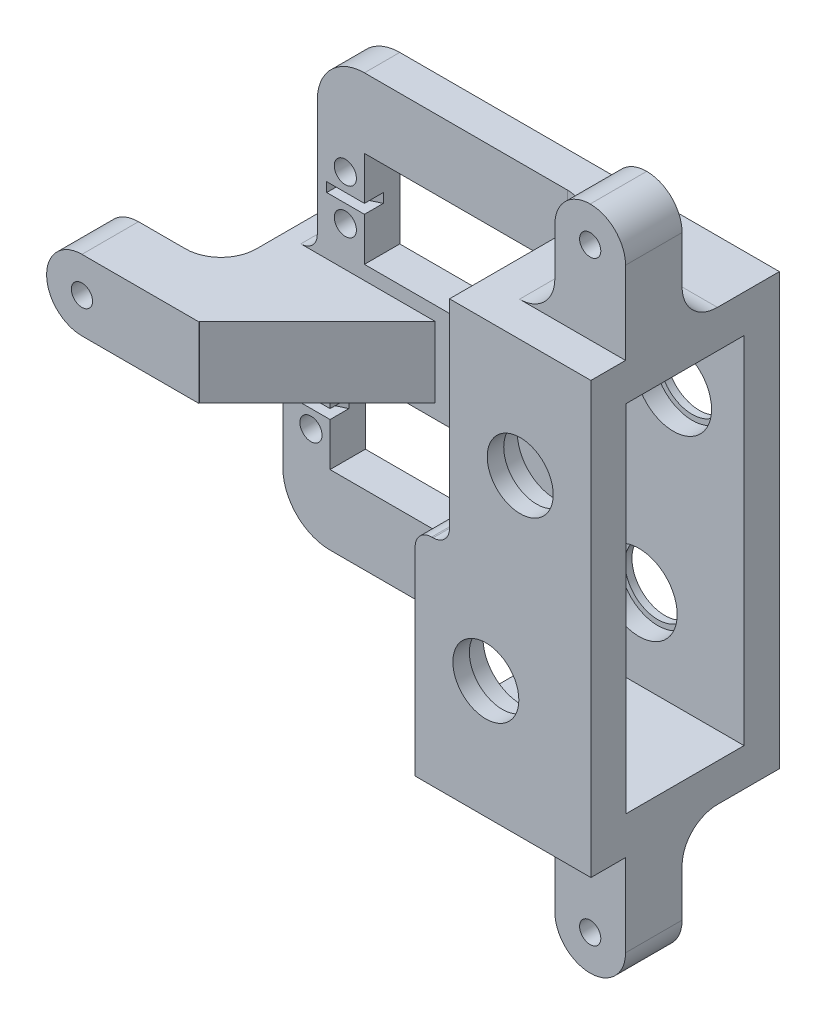
from build123d import *
from OCP.BRepFilletAPI import BRepFilletAPI_MakeChamfer

# Parameters (mm, degrees)
SKETCH1_W                      = 37.293223462
SKETCH1_H                      = 91.361925627
SKETCH1_R                      = 8.1
BOSS_EXTRUDE1_DEPTH            = 40
CUT_EXTRUDE1_START             = 8
SKETCH2_W                      = 37.293223462
SKETCH2_H                      = 25
CUT_EXTRUDE1_DEPTH             = 95.195837814
BOSS_EXTRUDE2_START            = -3.5
SKETCH10_R                     = 8.1
SKETCH10_R_2                   = 7
SKETCH10_R_3                   = 10.837031589
BOSS_EXTRUDE2_DEPTH            = 3.5
SKETCH11_R                     = 8.1
SKETCH11_R_2                   = 7
BOSS_EXTRUDE3_DEPTH            = 3.5
SKETCH12_W                     = 40.9
SKETCH12_H                     = 20.4
BOSS_EXTRUDE4_DEPTH            = 7.5
CUT_EXTRUDE2_REACH             = 127.125
SKETCH13_R                     = 2.3495
SKETCH22_W                     = 8
SKETCH22_H                     = 2
CUT_EXTRUDE6_DEPTH             = 2
SKETCH14_W                     = 37.293223462
SKETCH14_H                     = 8
BOSS_EXTRUDE5_DEPTH            = 25
CUT_EXTRUDE4_START             = -32.5
SKETCH18_W                     = 7.293223462
SKETCH18_H                     = 45.680962814
CUT_EXTRUDE4_DEPTH             = 32.5
SKETCH15_R                     = 11
CUT_EXTRUDE3_DEPTH             = 2
SKETCH19_W                     = 15
SKETCH19_H                     = 25
BOSS_EXTRUDE6_DEPTH            = 12
SKETCH20_W                     = 32.293223462
SKETCH20_H                     = 15
BOSS_EXTRUDE7_DEPTH            = 12
SKETCH21_W                     = 7.293223462
SKETCH21_H                     = 15
BOSS_EXTRUDE8_DEPTH            = 20.65
CHAMFER2_SIZE                  = 2
CHAMFER2_SIZE2                 = 4.289013841
FILLET1_R                      = 7.5
CHAMFER1_SIZE                  = 25
M4_CLEARANCE_HOLE1_D           = 4.5
M4_CLEARANCE_HOLE1_CSINK_D     = 4.55
M4_CLEARANCE_HOLE1_CSINK_ANGLE = 90
FILLET2_R                      = 10
FILLET3_R                      = 3.5


with BuildPart() as part:
    # Sketch1 → Boss-Extrude1 (new body)
    with BuildSketch(Plane.XY):
        with Locations((3.646611731, 45.680962814)):
            Rectangle(SKETCH1_W, SKETCH1_H)
        with Locations((0, 25)):
            Circle(SKETCH1_R, mode=Mode.SUBTRACT)
        with Locations((7.293223462, 66.361925627)):
            Circle(SKETCH1_R, mode=Mode.SUBTRACT)
    extrude(amount=BOSS_EXTRUDE1_DEPTH)

    # Sketch2 → Cut-Extrude1 (cut, through all)
    with BuildSketch(Plane(origin=(0, 0, 0), x_dir=(1, 0, 0), z_dir=(0, 1, 0)).offset(CUT_EXTRUDE1_START)):
        with Locations((3.646611731, -20)):
            Rectangle(SKETCH2_W, SKETCH2_H)
    extrude(amount=CUT_EXTRUDE1_DEPTH, mode=Mode.SUBTRACT)

    # Sketch10 → Boss-Extrude2 (add)
    # profile 1 of 2: a face of its own
    with BuildSketch(Plane.XY.offset(40).offset(BOSS_EXTRUDE2_START)):
        with Locations(Location((7.293223462, 66.361925627, 0), (0, 0, 180))):
            Circle(SKETCH10_R)
        with Locations((7.293223462, 66.361925627)):
            Circle(SKETCH10_R_2, mode=Mode.SUBTRACT)
    # profile 2 of 2: a face of its own
    with BuildSketch(Plane.XY.offset(40).offset(BOSS_EXTRUDE2_START)):
        with Locations((0, 25)):
            Circle(SKETCH10_R_3)
        with Locations((0, 25)):
            Circle(SKETCH10_R_2, mode=Mode.SUBTRACT)
    extrude(amount=BOSS_EXTRUDE2_DEPTH)

    # Sketch11 → Boss-Extrude3 (add)
    # profile 1 of 2: a face of its own
    with BuildSketch(Plane(origin=(0, 0, 0), x_dir=(-1, 0, 0), z_dir=(0, 0, -1))):
        with Locations((-7.293223462, 66.361925627)):
            Circle(SKETCH11_R)
        with Locations(Location((-7.293223462, 66.361925627, 0), (0, 0, 180))):
            Circle(SKETCH11_R_2, mode=Mode.SUBTRACT)
    # profile 2 of 2: a face of its own
    with BuildSketch(Plane(origin=(0, 0, 0), x_dir=(-1, 0, 0), z_dir=(0, 0, -1))):
        with Locations((0, 25)):
            Circle(SKETCH11_R)
        with Locations(Location((0, 25, 0), (0, 0, 180))):
            Circle(SKETCH11_R_2, mode=Mode.SUBTRACT)
    extrude(amount=-BOSS_EXTRUDE3_DEPTH)

    # Sketch12 → Boss-Extrude4 (add)
    with BuildSketch(Plane(origin=(0, 0, 0), x_dir=(-1, 0, 0), z_dir=(0, 0, -1))):
        Polygon((15, 0), (75.56, 0), (75.56, 45.680962813), (68.266776538, 45.680962813), (68.266776538, 91.361925627), (15, 91.361925627), align=None)
        with Locations((45.11, 25)):
            Rectangle(SKETCH12_W, SKETCH12_H, mode=Mode.SUBTRACT)
        with Locations((37.816776538, 66.361925627)):
            Rectangle(SKETCH12_W, SKETCH12_H, mode=Mode.SUBTRACT)
    extrude(amount=-BOSS_EXTRUDE4_DEPTH)

    # Sketch13 → Cut-Extrude2 (cut, up to next)
    with BuildSketch(Plane(origin=(0, 0, 0), x_dir=(-1, 0, 0), z_dir=(0, 0, -1)), mode=Mode.PRIVATE) as cut_extrude2_sk1:
        with Locations((20.61, 29.75)):
            Circle(SKETCH13_R)
    cut_extrude2_tool1 = extrude(cut_extrude2_sk1.sketch, amount=-CUT_EXTRUDE2_REACH, mode=Mode.PRIVATE) & part.part
    # Sketch13 → Cut-Extrude2 (cut, up to next)
    with BuildSketch(Plane(origin=(0, 0, 0), x_dir=(-1, 0, 0), z_dir=(0, 0, -1)), mode=Mode.PRIVATE) as cut_extrude2_sk2:
        with Locations((20.61, 20.25)):
            Circle(SKETCH13_R)
    cut_extrude2_tool2 = extrude(cut_extrude2_sk2.sketch, amount=-CUT_EXTRUDE2_REACH, mode=Mode.PRIVATE) & part.part
    # Sketch13 → Cut-Extrude2 (cut, up to next)
    with BuildSketch(Plane(origin=(0, 0, 0), x_dir=(-1, 0, 0), z_dir=(0, 0, -1)), mode=Mode.PRIVATE) as cut_extrude2_sk3:
        with Locations((69.61, 29.75)):
            Circle(SKETCH13_R)
    cut_extrude2_tool3 = extrude(cut_extrude2_sk3.sketch, amount=-CUT_EXTRUDE2_REACH, mode=Mode.PRIVATE) & part.part
    # Sketch13 → Cut-Extrude2 (cut, up to next)
    with BuildSketch(Plane(origin=(0, 0, 0), x_dir=(-1, 0, 0), z_dir=(0, 0, -1)), mode=Mode.PRIVATE) as cut_extrude2_sk4:
        with Locations((69.61, 20.25)):
            Circle(SKETCH13_R)
    cut_extrude2_tool4 = extrude(cut_extrude2_sk4.sketch, amount=-CUT_EXTRUDE2_REACH, mode=Mode.PRIVATE) & part.part
    # Sketch13 → Cut-Extrude2 (cut, up to next)
    with BuildSketch(Plane(origin=(0, 0, 0), x_dir=(-1, 0, 0), z_dir=(0, 0, -1)), mode=Mode.PRIVATE) as cut_extrude2_sk5:
        with Locations((13.316776538, 71.111925627)):
            Circle(SKETCH13_R)
    cut_extrude2_tool5 = extrude(cut_extrude2_sk5.sketch, amount=-CUT_EXTRUDE2_REACH, mode=Mode.PRIVATE) & part.part
    # Sketch13 → Cut-Extrude2 (cut, up to next)
    with BuildSketch(Plane(origin=(0, 0, 0), x_dir=(-1, 0, 0), z_dir=(0, 0, -1)), mode=Mode.PRIVATE) as cut_extrude2_sk6:
        with Locations((13.316776538, 61.611925627)):
            Circle(SKETCH13_R)
    cut_extrude2_tool6 = extrude(cut_extrude2_sk6.sketch, amount=-CUT_EXTRUDE2_REACH, mode=Mode.PRIVATE) & part.part
    # Sketch13 → Cut-Extrude2 (cut, up to next)
    with BuildSketch(Plane(origin=(0, 0, 0), x_dir=(-1, 0, 0), z_dir=(0, 0, -1)), mode=Mode.PRIVATE) as cut_extrude2_sk7:
        with Locations((62.316776538, 71.111925627)):
            Circle(SKETCH13_R)
    cut_extrude2_tool7 = extrude(cut_extrude2_sk7.sketch, amount=-CUT_EXTRUDE2_REACH, mode=Mode.PRIVATE) & part.part
    # Sketch13 → Cut-Extrude2 (cut, up to next)
    with BuildSketch(Plane(origin=(0, 0, 0), x_dir=(-1, 0, 0), z_dir=(0, 0, -1)), mode=Mode.PRIVATE) as cut_extrude2_sk8:
        with Locations((62.316776538, 61.611925627)):
            Circle(SKETCH13_R)
    cut_extrude2_tool8 = extrude(cut_extrude2_sk8.sketch, amount=-CUT_EXTRUDE2_REACH, mode=Mode.PRIVATE) & part.part
    add(cut_extrude2_tool1.solids().sort_by_distance((-20.61, 29.75, 0))[0], mode=Mode.SUBTRACT)
    add(cut_extrude2_tool2.solids().sort_by_distance((-20.61, 20.25, 0))[0], mode=Mode.SUBTRACT)
    add(cut_extrude2_tool3.solids().sort_by_distance((-69.61, 29.75, 0))[0], mode=Mode.SUBTRACT)
    add(cut_extrude2_tool4.solids().sort_by_distance((-69.61, 20.25, 0))[0], mode=Mode.SUBTRACT)
    add(cut_extrude2_tool5.solids().sort_by_distance((-13.316777, 71.111926, 0))[0], mode=Mode.SUBTRACT)
    add(cut_extrude2_tool6.solids().sort_by_distance((-13.316777, 61.611926, 0))[0], mode=Mode.SUBTRACT)
    add(cut_extrude2_tool7.solids().sort_by_distance((-62.316777, 71.111926, 0))[0], mode=Mode.SUBTRACT)
    add(cut_extrude2_tool8.solids().sort_by_distance((-62.316777, 61.611926, 0))[0], mode=Mode.SUBTRACT)

    # Sketch22 → Cut-Extrude6 (cut)
    with BuildSketch(Plane.XY.offset(7.5)):
        with Locations((-62.266776538, 66.361925627)):
            Rectangle(SKETCH22_W, SKETCH22_H)
        with Locations((-13.366776538, 66.361925627)):
            Rectangle(SKETCH22_W, SKETCH22_H)
        with Locations((-20.66, 25)):
            Rectangle(SKETCH22_W, SKETCH22_H)
        with Locations((-69.56, 25)):
            Rectangle(SKETCH22_W, SKETCH22_H)
    extrude(amount=-CUT_EXTRUDE6_DEPTH, mode=Mode.SUBTRACT)

    # Sketch14 → Boss-Extrude5 (add)
    with BuildSketch(Plane.XY.offset(7.5)):
        with Locations((3.646611731, 87.361925627)):
            Rectangle(SKETCH14_W, SKETCH14_H)
    extrude(amount=BOSS_EXTRUDE5_DEPTH)

    # Sketch18 → Cut-Extrude4 (cut)
    with BuildSketch(Plane.XY.offset(40).offset(CUT_EXTRUDE4_START)):
        with Locations((-11.353388269, 68.52144422)):
            Rectangle(SKETCH18_W, SKETCH18_H)
    extrude(amount=CUT_EXTRUDE4_DEPTH, mode=Mode.SUBTRACT)

    # Sketch15 → Cut-Extrude3 (cut)
    with BuildSketch(Plane(origin=(0, 0, 0), x_dir=(-1, 0, 0), z_dir=(0, 0, -1))):
        with Locations((0, 25)):
            Circle(SKETCH15_R)
        with Locations((-7.293223462, 66.361925627)):
            Circle(SKETCH15_R)
    extrude(amount=-CUT_EXTRUDE3_DEPTH, mode=Mode.SUBTRACT)

    # Sketch19 → Boss-Extrude6 (add)
    with BuildSketch(Plane.XY.offset(32.65)):
        with Locations((14.793223462, 103.861925627)):
            Rectangle(SKETCH19_W, SKETCH19_H)
        with Locations((14.793223462, -12.5)):
            Rectangle(SKETCH19_W, SKETCH19_H)
    extrude(amount=-BOSS_EXTRUDE6_DEPTH)



with BuildPart() as body_2:
    # Sketch20 → Boss-Extrude7 (new body)
    with BuildSketch(Plane.XY.offset(32.65)):
        with Locations((-84.413388269, 45.680962813)):
            Rectangle(SKETCH20_W, SKETCH20_H)
    extrude(amount=-BOSS_EXTRUDE7_DEPTH)


with BuildPart() as part_1:
    add(part.part)

    add(body_2.part)  # Boss-Extrude8 merges body 2
    # Sketch21 → Boss-Extrude8 (add)
    with BuildSketch(Plane(origin=(0, 0, 20.65), x_dir=(-1, 0, 0), z_dir=(0, 0, -1))):
        with Locations((71.913388269, 45.680962813)):
            Rectangle(SKETCH21_W, SKETCH21_H)
    extrude(amount=BOSS_EXTRUDE8_DEPTH)

    # Chamfer2: one chamfer whose edges measure the first distance from different faces: ONE call of the kernel's chamfer builder (chamfer() names one face for all edges)
    chamfer2_edges_1 = [part_1.edges().sort_by_distance(p)[0] for p in [
        (-65.56, 25, 5.5),
    ]]
    chamfer2_side_1 = [part_1.faces().sort_by_distance(p)[0] for p in [
        (-65.56, 25, 3.676174497),
    ]]
    chamfer2_edges_2 = [part_1.edges().sort_by_distance(p)[0] for p in [
        (-24.66, 25, 5.5),
    ]]
    chamfer2_side_2 = [part_1.faces().sort_by_distance(p)[0] for p in [
        (-24.66, 25, 3.676174497),
    ]]
    chamfer2_edges_3 = [part_1.edges().sort_by_distance(p)[0] for p in [
        (-17.366776538, 66.361925627, 5.5),
    ]]
    chamfer2_side_3 = [part_1.faces().sort_by_distance(p)[0] for p in [
        (-17.366776538, 66.361925627, 3.676174497),
    ]]
    chamfer2_edges_4 = [part_1.edges().sort_by_distance(p)[0] for p in [
        (-58.266776538, 66.361925627, 5.5),
    ]]
    chamfer2_side_4 = [part_1.faces().sort_by_distance(p)[0] for p in [
        (-58.266776538, 66.361925627, 3.676174497),
    ]]
    chamfer2 = BRepFilletAPI_MakeChamfer(part_1.part.solid().wrapped)
    for e in chamfer2_edges_1:
        chamfer2.Add(CHAMFER2_SIZE, CHAMFER2_SIZE2, e.wrapped, chamfer2_side_1[0].wrapped)  # the first distance lies on this face
    for e in chamfer2_edges_2:
        chamfer2.Add(CHAMFER2_SIZE, CHAMFER2_SIZE2, e.wrapped, chamfer2_side_2[0].wrapped)  # the first distance lies on this face
    for e in chamfer2_edges_3:
        chamfer2.Add(CHAMFER2_SIZE, CHAMFER2_SIZE2, e.wrapped, chamfer2_side_3[0].wrapped)  # the first distance lies on this face
    for e in chamfer2_edges_4:
        chamfer2.Add(CHAMFER2_SIZE, CHAMFER2_SIZE2, e.wrapped, chamfer2_side_4[0].wrapped)  # the first distance lies on this face
    add(Compound.cast(chamfer2.Shape()), mode=Mode.REPLACE)

    # Fillet1
    fillet1_edges = [part_1.edges().sort_by_distance(p)[0] for p in [
        (-100.56, 53.180962813, 26.65),
        (-100.56, 38.180962813, 26.65),
        (-75.56, 45.680962813, 20.65),
        (7.293223462, 116.361925627, 26.65),
        (22.293223462, 116.361925627, 26.65),
        (7.293223462, -25, 26.65),
        (22.293223462, -25, 26.65),
        (14.793223462, 0, 20.65),
        (14.793223462, 91.361925627, 20.65),
        (7.293223462, 0, 26.65),
        (7.293223462, 91.361925627, 26.65),
        (-7.706776538, 87.361925627, 7.5),
        (-15, 4, 7.5),
    ]]
    fillet(fillet1_edges, radius=FILLET1_R - 0.0001)  # a hair under: the kernel refuses the full size

    # Chamfer1
    chamfer1_edges = [part_1.edges().sort_by_distance(p)[0] for p in [
        (-68.266776538, 45.680962813, 7.5),
    ]]
    chamfer(chamfer1_edges, length=CHAMFER1_SIZE)

    # M4 Clearance Hole1 (through all)
    with Locations(Plane(origin=(0, 0, 20.65), x_dir=(-1, 0, 0), z_dir=(0, 0, -1))):
        with Locations((-14.793223462, 108.861925627), (93.06, 45.680962813), (-14.793223462, -17.5)):
            CounterSinkHole(M4_CLEARANCE_HOLE1_D / 2, M4_CLEARANCE_HOLE1_CSINK_D / 2, counter_sink_angle=M4_CLEARANCE_HOLE1_CSINK_ANGLE)

    # Fillet2
    fillet2_edges = [part_1.edges().sort_by_distance(p)[0] for p in [
        (-68.266776538, 91.361925627, 3.75),
        (-75.56, 0, 3.75),
    ]]
    fillet(fillet2_edges, radius=FILLET2_R)

    # Fillet3
    fillet3_edges = [part_1.edges().sort_by_distance(p)[0] for p in [
        (-15, 45.680962813, 36.25),
        (-7.706776538, 45.680962813, 36.25),
        (-68.266776538, 53.180962813, 3.75),
    ]]
    fillet(fillet3_edges, radius=FILLET3_R)


solid = part_1.part
